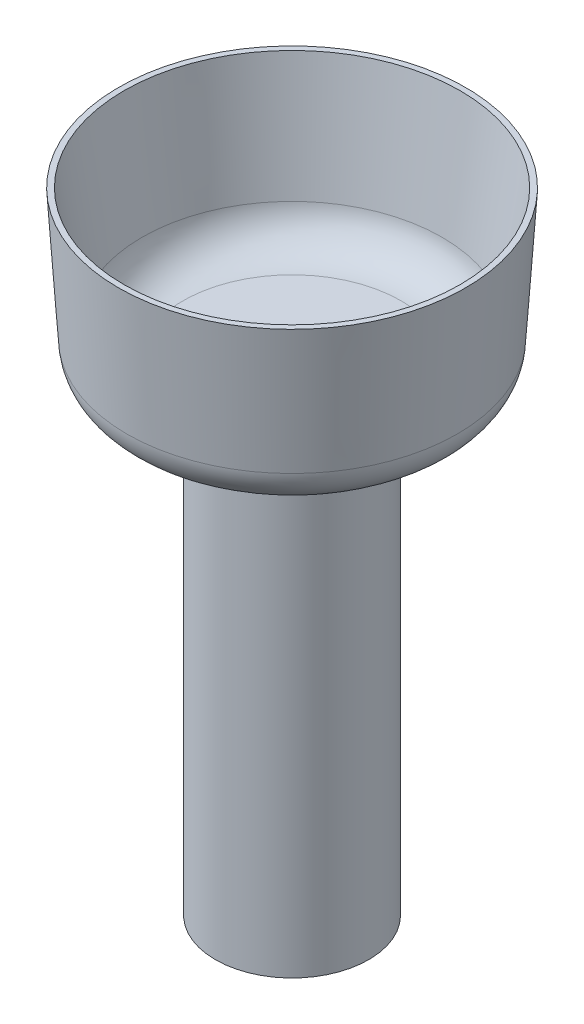
from build123d import *

# Parameters (mm, degrees)
SKETCH1_R           = 5.6
BOSS_EXTRUDE1_DEPTH = 33.67
SKETCH2_R           = 11.885
SKETCH3_R           = 12.675
FILLET1_R           = 3
CHAMFER1_SIZE       = 0.8
CHAMFER1_SIZE2      = 9
FILLET2_R           = 3


# Read off the part's stored shape, not the designer's step: Shell1
with BuildPart() as part:
    # Sketch1 → Boss-Extrude1 (new body)
    with BuildSketch(Plane(origin=(0, 0, 0), x_dir=(1, 0, 0), z_dir=(0, 1, 0))):
        with Locations(Location((0, 0, 0), (0, 0, 270))):
            Circle(SKETCH1_R)
    extrude(amount=BOSS_EXTRUDE1_DEPTH)

    # Sketch2 → Loft1 section 0
    with BuildSketch(Plane(origin=(0, 33.67, 0), x_dir=(1, 0, 0), z_dir=(0, 1, 0))):
        Circle(SKETCH2_R)
    # Sketch3 → Loft1 section 1
    with BuildSketch(Plane(origin=(0, 46.03, 0), x_dir=(1, 0, 0), z_dir=(0, 1, 0))):
        Circle(SKETCH3_R)
    loft()

    # Shell1 outline → Shell1 (revolve, cut)
    with BuildSketch(Plane.XY):
        Polygon((0, 46.03), (0, 34.87), (10.759250385, 34.87), (11.472551356, 46.03), align=None)
    revolve(axis=Axis((0, 0, 0), (0, 1, 0)), mode=Mode.SUBTRACT)

    # Fillet1
    fillet1_edges = [part.edges().sort_by_distance(p)[0] for p in [
        (-11.885, 33.67, 0),
    ]]
    fillet(fillet1_edges, radius=FILLET1_R)

    # Chamfer1
    chamfer1_edges = [part.edges().sort_by_distance(p)[0] for p in [
        (-11.472551356, 46.03, 0),
    ]]
    chamfer1_side = [part.faces().sort_by_distance(p)[0] for p in [
        (-12.316496862, 46.03, 0),
    ]]
    chamfer(chamfer1_edges, length=CHAMFER1_SIZE, length2=CHAMFER1_SIZE2, reference=chamfer1_side[0])

    # Fillet2
    fillet2_edges = [part.edges().sort_by_distance(p)[0] for p in [
        (-10.759250385, 34.87, 0),
    ]]
    fillet(fillet2_edges, radius=FILLET2_R)


solid = part.part
